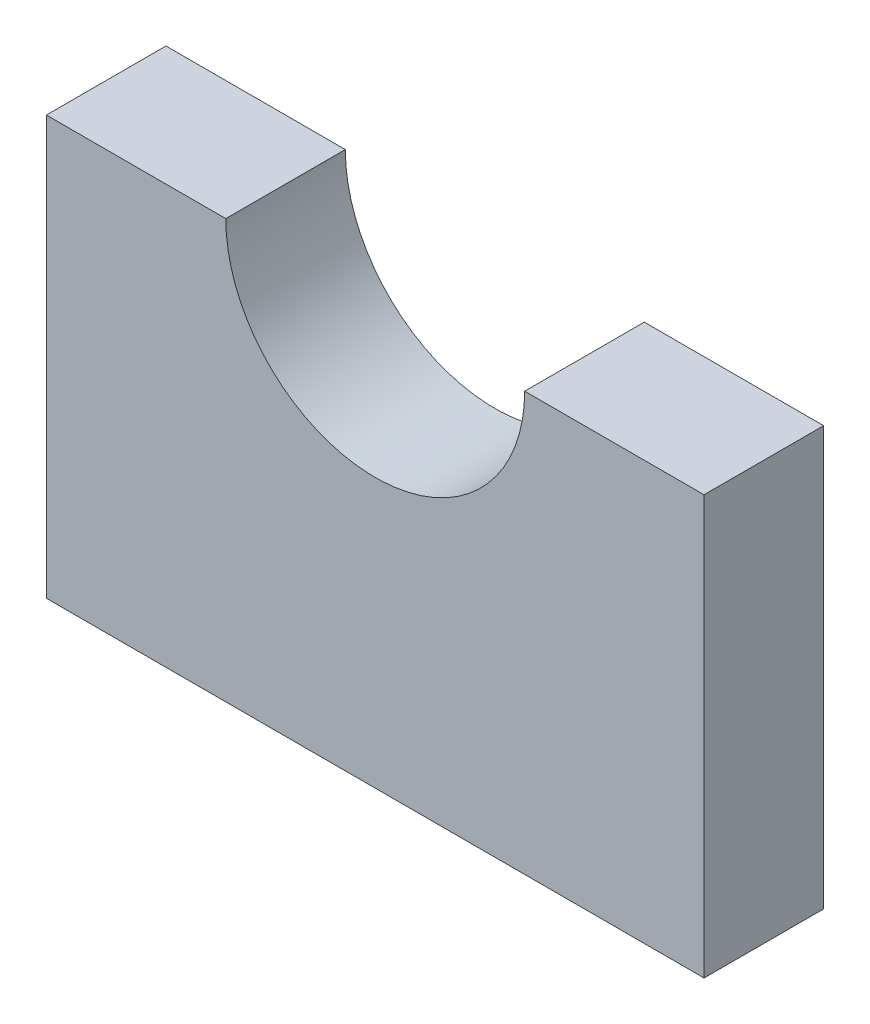
from build123d import *

# Parameters (mm, degrees)
SKETCH1_W           = 69.85
SKETCH1_H           = 12.7
BOSS_EXTRUDE1_DEPTH = 44.45
SKETCH3_R           = 15.875
CUT_EXTRUDE3_DEPTH  = 25.4
SKETCH4_R           = 1.27
CUT_EXTRUDE4_DEPTH  = 5.08


with BuildPart() as part:
    # Sketch1 → Boss-Extrude1 (new body)
    with BuildSketch(Plane(origin=(0, 0, 0), x_dir=(1, 0, 0), z_dir=(0, 1, 0))):
        Rectangle(SKETCH1_W, SKETCH1_H)
    extrude(amount=BOSS_EXTRUDE1_DEPTH)

    # Sketch3 → Cut-Extrude3 (cut)
    with BuildSketch(Plane(origin=(0, 0, -6.35), x_dir=(-1, 0, 0), z_dir=(0, 0, -1))):
        with Locations((0, 44.45)):
            Circle(SKETCH3_R)
    extrude(amount=-CUT_EXTRUDE3_DEPTH, mode=Mode.SUBTRACT)

    # Sketch4 → Cut-Extrude4 (cut)
    with BuildSketch(Plane(origin=(0, 0, 0), x_dir=(-1, 0, 0), z_dir=(0, -1, 0))):
        with Locations((25.4, 0)):
            Circle(SKETCH4_R)
        with Locations((-25.4, 0)):
            Circle(SKETCH4_R)
    extrude(amount=-CUT_EXTRUDE4_DEPTH, mode=Mode.SUBTRACT)


solid = part.part
